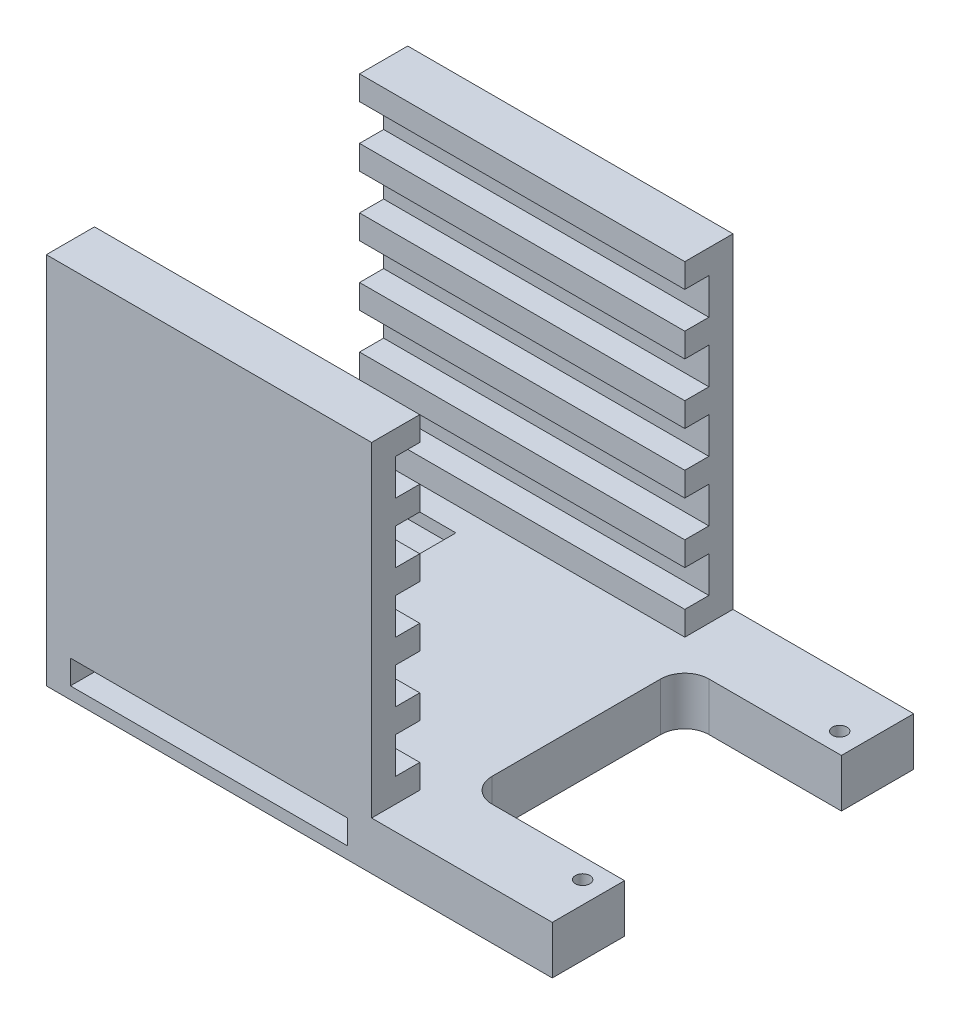
from build123d import *

# Parameters (mm, degrees)
BOSS_EXTRUDE1_DEPTH      = 2
BOSS_EXTRUDE1_DEPTH_BACK = 2
SKETCH1_W                = 40
SKETCH1_H                = 30
SKETCH2_W                = 25
SKETCH2_H                = 4
BOSS_EXTRUDE2_DEPTH      = 27
SKETCH3_W                = 13
SKETCH3_H                = 18
CUT_EXTRUDE1_DEPTH       = 5
SKETCH4_R                = 0.6
CUT_EXTRUDE5_DEPTH       = 37.796738986
FILLET3_R                = 2
BOSS_EXTRUDE5_DEPTH      = 2
SKETCH11_W               = 2
SKETCH11_H               = 3
CUT_EXTRUDE6_DEPTH       = 43.367440329
LPATTERN1_COUNT          = 5
LPATTERN1_PITCH          = 5
MIRROR6_COPY_1_SKETCH_W  = 2
MIRROR6_COPY_1_SKETCH_H  = 3
MIRROR6_COPY_1_DEPTH     = 43.367440329
MIRROR6_COPY_2_SKETCH_W  = 2
MIRROR6_COPY_2_SKETCH_H  = 3
MIRROR6_COPY_2_DEPTH     = 43.367440329
MIRROR6_COPY_3_SKETCH_W  = 2
MIRROR6_COPY_3_SKETCH_H  = 3
MIRROR6_COPY_3_DEPTH     = 43.367440329
MIRROR6_COPY_4_SKETCH_W  = 2
MIRROR6_COPY_4_SKETCH_H  = 3
MIRROR6_COPY_4_DEPTH     = 43.367440329
MIRROR6_COPY_5_SKETCH_W  = 2
MIRROR6_COPY_5_SKETCH_H  = 3
MIRROR6_COPY_5_DEPTH     = 43.367440329
SKETCH12_W               = 23
SKETCH12_H               = 2
CUT_EXTRUDE7_DEPTH       = 30
SKETCH13_W               = 10
SKETCH13_H               = 18
CUT_EXTRUDE8_DEPTH       = 2


with BuildPart() as part:
    # Sketch1 → Boss-Extrude1 (new, two sides: drawn at the far end of the back side and taken through both)
    with BuildSketch(Plane(origin=(0, 0, 0), x_dir=(1, 0, 0), z_dir=(0, 1, 0)).offset(-BOSS_EXTRUDE1_DEPTH_BACK)):
        Rectangle(SKETCH1_W, SKETCH1_H)
    extrude(amount=BOSS_EXTRUDE1_DEPTH + BOSS_EXTRUDE1_DEPTH_BACK)

    # Sketch2 → Boss-Extrude2 (add)
    with BuildSketch(Plane(origin=(0, 2, 0), x_dir=(1, 0, 0), z_dir=(0, 1, 0))):
        with Locations((-7.5, 13)):
            Rectangle(SKETCH2_W, SKETCH2_H)
    boss_extrude2 = extrude(amount=BOSS_EXTRUDE2_DEPTH)

    # Mirror1: Boss-Extrude2 across plane
    add(boss_extrude2.mirror(Plane.XY))

    # Sketch3 → Cut-Extrude1 (cut)
    with BuildSketch(Plane(origin=(0, 2, 0), x_dir=(1, 0, 0), z_dir=(0, 1, 0))):
        with Locations((13.5, 0)):
            Rectangle(SKETCH3_W, SKETCH3_H)
    extrude(amount=-CUT_EXTRUDE1_DEPTH, mode=Mode.SUBTRACT)

    # Sketch4 → Cut-Extrude5 (cut, through all)
    with BuildSketch(Plane(origin=(0, 2, 0), x_dir=(1, 0, 0), z_dir=(0, 1, 0))):
        with Locations((18.188184095, -10.67)):
            Circle(SKETCH4_R)
    cut_extrude5 = extrude(amount=-CUT_EXTRUDE5_DEPTH, mode=Mode.SUBTRACT)

    # Fillet3
    fillet3_edges = [part.edges().sort_by_distance(p)[0] for p in [
        (7, 0, 9),
        (7, 0, -9),
    ]]
    fillet(fillet3_edges, radius=FILLET3_R)

    # Mirror5: Cut-Extrude5 across plane
    add(cut_extrude5.mirror(Plane.XY), mode=Mode.SUBTRACT)

    # Sketch8 → Boss-Extrude5 (add)
    with BuildSketch(Plane.ZY.offset(20)):
        Polygon((-15, -2), (15, -2), (15, 29), (11, 29), (11, 2), (-11, 2), (-11, 29), (-15, 29), align=None)
    extrude(amount=BOSS_EXTRUDE5_DEPTH)

    # Sketch11 → Cut-Extrude6 (cut, through all)
    with BuildSketch(Plane(origin=(5, 0, 0), x_dir=(0, 0, -1), z_dir=(1, 0, 0))):
        with Locations((12, 5.5)):
            Rectangle(SKETCH11_W, SKETCH11_H)
    cut_extrude6 = extrude(amount=-CUT_EXTRUDE6_DEPTH, mode=Mode.SUBTRACT)

    # LPattern1: Cut-Extrude6 ×5
    with Locations(*[(0, i * LPATTERN1_PITCH, 0) for i in range(1, LPATTERN1_COUNT)]):
        add(cut_extrude6, mode=Mode.SUBTRACT)

    # Mirror6 copy 1 sketch → Mirror6 copy 1 (cut, through all)
    with BuildSketch(Plane(origin=(5, 5, 0), x_dir=(0, 0, 1), z_dir=(1, 0, 0))):
        with Locations((12, -5.5)):
            Rectangle(MIRROR6_COPY_1_SKETCH_W, MIRROR6_COPY_1_SKETCH_H)
    extrude(amount=-MIRROR6_COPY_1_DEPTH, mode=Mode.SUBTRACT)

    # Mirror6 copy 2 sketch → Mirror6 copy 2 (cut, through all)
    with BuildSketch(Plane(origin=(5, 10, 0), x_dir=(0, 0, 1), z_dir=(1, 0, 0))):
        with Locations((12, -5.5)):
            Rectangle(MIRROR6_COPY_2_SKETCH_W, MIRROR6_COPY_2_SKETCH_H)
    extrude(amount=-MIRROR6_COPY_2_DEPTH, mode=Mode.SUBTRACT)

    # Mirror6 copy 3 sketch → Mirror6 copy 3 (cut, through all)
    with BuildSketch(Plane(origin=(5, 15, 0), x_dir=(0, 0, 1), z_dir=(1, 0, 0))):
        with Locations((12, -5.5)):
            Rectangle(MIRROR6_COPY_3_SKETCH_W, MIRROR6_COPY_3_SKETCH_H)
    extrude(amount=-MIRROR6_COPY_3_DEPTH, mode=Mode.SUBTRACT)

    # Mirror6 copy 4 sketch → Mirror6 copy 4 (cut, through all)
    with BuildSketch(Plane(origin=(5, 20, 0), x_dir=(0, 0, 1), z_dir=(1, 0, 0))):
        with Locations((12, -5.5)):
            Rectangle(MIRROR6_COPY_4_SKETCH_W, MIRROR6_COPY_4_SKETCH_H)
    extrude(amount=-MIRROR6_COPY_4_DEPTH, mode=Mode.SUBTRACT)

    # Mirror6 copy 5 sketch → Mirror6 copy 5 (cut, through all)
    with BuildSketch(Plane(origin=(5, 0, 0), x_dir=(0, 0, 1), z_dir=(1, 0, 0))):
        with Locations((12, -5.5)):
            Rectangle(MIRROR6_COPY_5_SKETCH_W, MIRROR6_COPY_5_SKETCH_H)
    extrude(amount=-MIRROR6_COPY_5_DEPTH, mode=Mode.SUBTRACT)

    # Sketch12 → Cut-Extrude7 (cut)
    with BuildSketch(Plane.XY.offset(15)):
        with Locations((-8.5, 0)):
            Rectangle(SKETCH12_W, SKETCH12_H)
    extrude(amount=-CUT_EXTRUDE7_DEPTH, mode=Mode.SUBTRACT)

    # Sketch13 → Cut-Extrude8 (cut)
    with BuildSketch(Plane(origin=(0, 2, 0), x_dir=(1, 0, 0), z_dir=(0, 1, 0))):
        with Locations((-17, 0)):
            Rectangle(SKETCH13_W, SKETCH13_H)
    extrude(amount=-CUT_EXTRUDE8_DEPTH, mode=Mode.SUBTRACT)


solid = part.part
